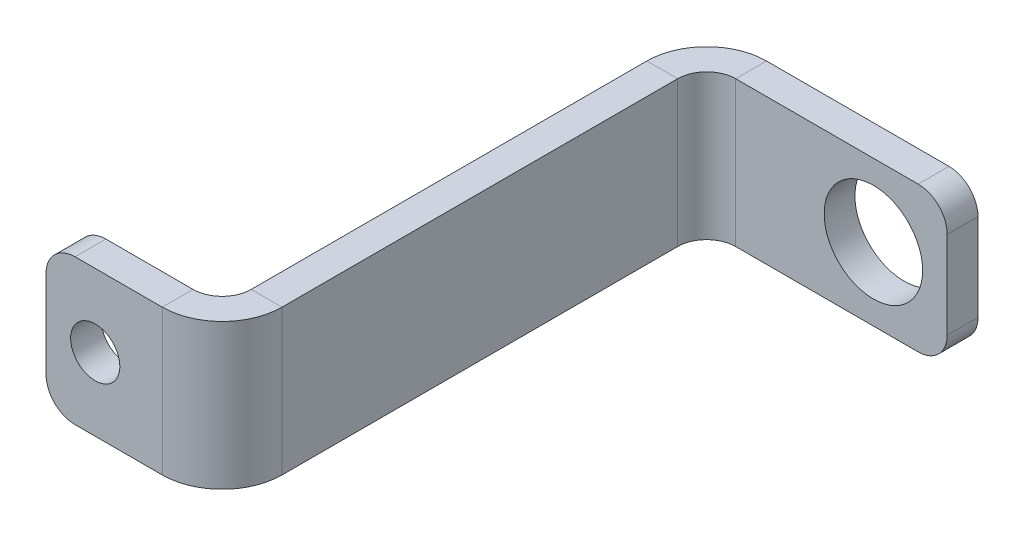
from build123d import *

# Parameters (mm, degrees)
SKETCH1_W                    = 15
SKETCH1_H                    = 15
BASE_FLANGE2_DEPTH           = 3.175
EDGE_FLANGE1_STRIP_W         = 18.7
EDGE_FLANGE1_STRIP_H         = 3.175
EDGE_FLANGE1_STRIP_CUT_DEPTH = 15
EDGE_FLANGE1_DEPTH           = 15
EDGE_FLANGE2_STRIP_W         = 18.7
EDGE_FLANGE2_STRIP_H         = 3.175
EDGE_FLANGE2_STRIP_CUT_DEPTH = 15
EDGE_FLANGE2_DEPTH           = 15
SKETCH18_R                   = 2.54
CUT_EXTRUDE1_DEPTH           = 65.374533979
SKETCH19_R                   = 5.08
CUT_EXTRUDE2_DEPTH           = 62.777827738
FILLET1_R                    = 3


# Sheet-metal steps are written as plain solids
with BuildPart() as part:
    # Sketch1 → Base-Flange2 (new body)
    with BuildSketch(Plane.XY):
        Rectangle(SKETCH1_W, SKETCH1_H)
    extrude(amount=-BASE_FLANGE2_DEPTH)

    # Edge-Flange1 strip (across the edge) → Edge-Flange1 strip cut (cut)
    with BuildSketch(Plane(origin=(7.5, 7.5, -3.175), x_dir=(-1, 0, 0), z_dir=(0, -1, 0))):
        with Locations((-6.35, -1.5875)):
            Rectangle(EDGE_FLANGE1_STRIP_W, EDGE_FLANGE1_STRIP_H)
    extrude(amount=EDGE_FLANGE1_STRIP_CUT_DEPTH, mode=Mode.SUBTRACT)

    # Edge-Flange1 section (across the edge) → Edge-Flange1 (add)
    with BuildSketch(Plane(origin=(7.5, 7.5, -3.175), x_dir=(-1, 0, 0), z_dir=(0, -1, 0))):
        with BuildLine():
            Line((-3.175, 3), (-3.175, 46.825))
            Line((-3.175, 46.825), (0, 46.825))
            Line((0, 46.825), (0, 3))
            ThreePointArc((0, 3), (0.878679656, 0.878679656), (3, 0))
            Line((3, 0), (3, -3.175))
            ThreePointArc((3, -3.175), (-1.366384374, -1.366384374), (-3.175, 3))
        make_face()
    extrude(amount=EDGE_FLANGE1_DEPTH)

    # Edge-Flange2 strip (across the edge) → Edge-Flange2 strip cut (cut)
    with BuildSketch(Plane(origin=(10.675, -7.5, -50), x_dir=(0, 0, 1), z_dir=(0, 1, 0))):
        with Locations((-6.35, -1.5875)):
            Rectangle(EDGE_FLANGE2_STRIP_W, EDGE_FLANGE2_STRIP_H)
    extrude(amount=EDGE_FLANGE2_STRIP_CUT_DEPTH, mode=Mode.SUBTRACT)

    # Edge-Flange2 section (across the edge) → Edge-Flange2 (add)
    with BuildSketch(Plane(origin=(10.675, -7.5, -50), x_dir=(0, 0, 1), z_dir=(0, 1, 0))):
        with BuildLine():
            Line((-3.175, 3), (-3.175, 24.825))
            Line((-3.175, 24.825), (0, 24.825))
            Line((0, 24.825), (0, 3))
            ThreePointArc((0, 3), (0.878679656, 0.878679656), (3, 0))
            Line((3, 0), (3, -3.175))
            ThreePointArc((3, -3.175), (-1.366384374, -1.366384374), (-3.175, 3))
        make_face()
    extrude(amount=EDGE_FLANGE2_DEPTH)

    # Sketch18 → Cut-Extrude1 (cut, through all)
    with BuildSketch(Plane.XY):
        with Locations((-2.42, 0)):
            Circle(SKETCH18_R)
    extrude(amount=-CUT_EXTRUDE1_DEPTH, mode=Mode.SUBTRACT)

    # Sketch19 → Cut-Extrude2 (cut, through all)
    with BuildSketch(Plane.XY.offset(-50)):
        with Locations((27.88, 0)):
            Circle(SKETCH19_R)
    extrude(amount=-CUT_EXTRUDE2_DEPTH, mode=Mode.SUBTRACT)

    # Fillet1
    fillet1_edges = [part.edges().sort_by_distance(p)[0] for p in [
        (35.5, -7.5, -51.5875),
        (35.5, 7.5, -51.5875),
        (-7.5, -7.5, -1.5875),
        (-7.5, 7.5, -1.5875),
    ]]
    fillet(fillet1_edges, radius=FILLET1_R)


solid = part.part
